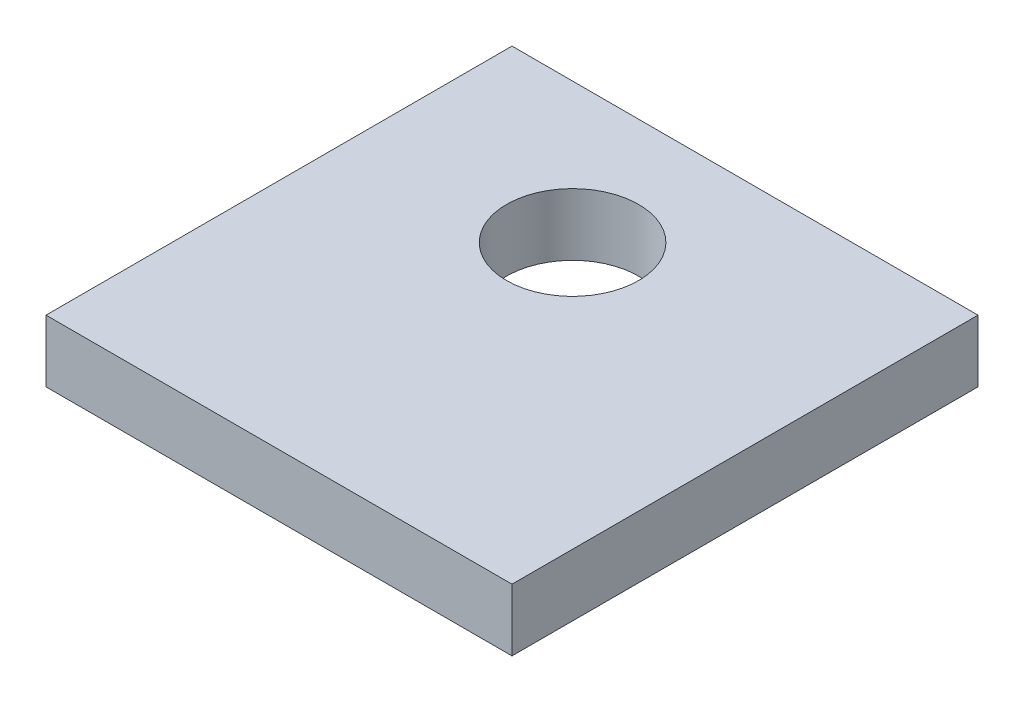
from build123d import *

# Parameters (mm, degrees)
SKETCH1_W           = 30
SKETCH1_H           = 30
BOSS_EXTRUDE1_DEPTH = 2
SKETCH2_R           = 4.25
CUT_EXTRUDE1_DEPTH  = 22.587033145


with BuildPart() as part:
    # Sketch1 → Boss-Extrude1 (new, symmetric)
    with BuildSketch(Plane(origin=(0, 0, 0), x_dir=(1, 0, 0), z_dir=(0, 1, 0))):
        Rectangle(SKETCH1_W, SKETCH1_H)
    extrude(amount=BOSS_EXTRUDE1_DEPTH, both=True)

    # Sketch2 → Cut-Extrude1 (cut, through all)
    with BuildSketch(Plane(origin=(0, 2, 0), x_dir=(1, 0, 0), z_dir=(0, 1, 0))):
        with Locations((-2.1, 6)):
            Circle(SKETCH2_R)
    extrude(amount=-CUT_EXTRUDE1_DEPTH, mode=Mode.SUBTRACT)


solid = part.part
